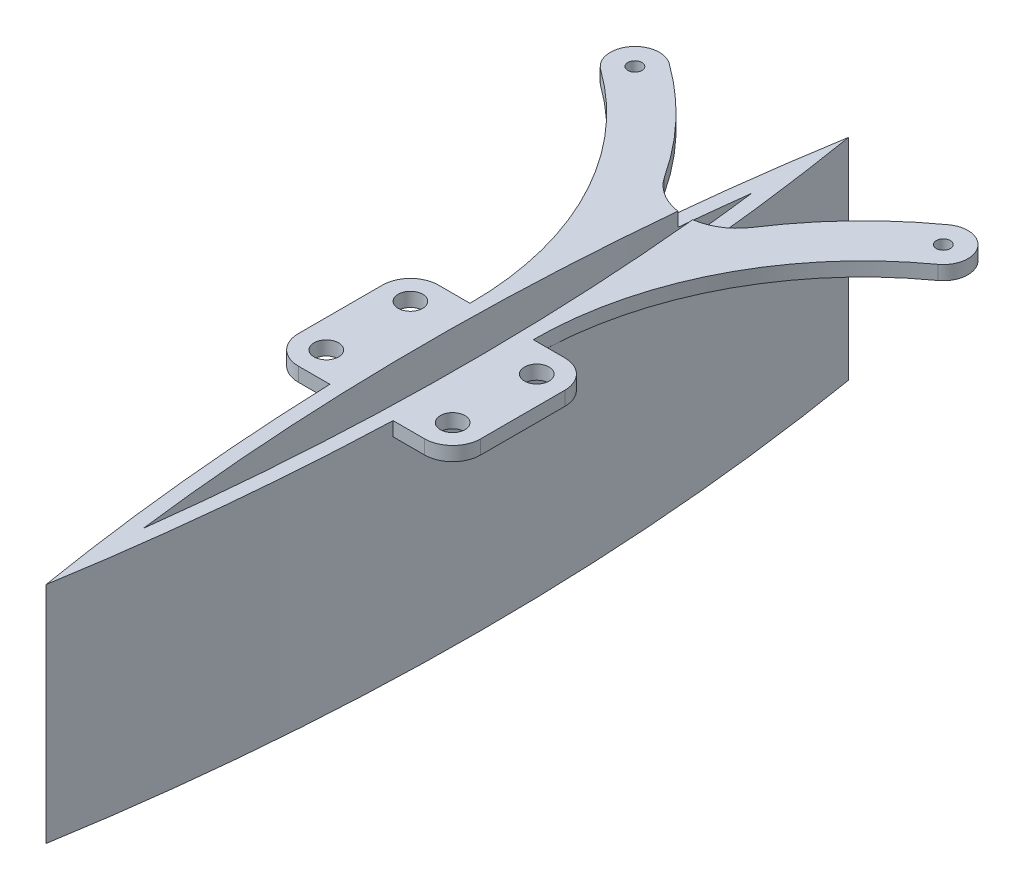
from build123d import *

# Parameters (mm, degrees)
ESQUISSE1_R             = 1
ESQUISSE1_R_2           = 1.75
BOSS_EXTRU_1_DEPTH      = 2
BOSS_EXTRU_2_DEPTH      = 30
ENL_V_MAT_EXTRU_1_DEPTH = 30


with BuildPart() as part:
    # Esquisse1 → Boss.-Extru.1 (new body)
    with BuildSketch(Plane(origin=(-102.847426705, 0, 18.134776225), x_dir=(-0.9358900387216226, 0, 0.3522922585320884), z_dir=(0, -1, 0))):
        with BuildLine():
            Line((-35.783043535, -7.317032149), (-31.571538361, -5.731716986))
            ThreePointArc((-31.571538361, -5.731716986), (-43.962728769, 12.509421297), (-63.307120355, 23.095980688))
            ThreePointArc((-63.307120355, 23.095980688), (-65.772276028, 27.388183794), (-61.480072922, 29.853339467))
            ThreePointArc((-61.480072922, 29.853339467), (-52.160976528, 26.38573664), (-43.635247367, 21.268924229))
            ThreePointArc((-43.635247367, 21.268924229), (-36.558040325, 20.298062653), (-31.877901634, 25.694888901))
            ThreePointArc((-31.877901634, 25.694888901), (-28.844792662, 35.160970009), (-24.13003355, 43.911826431))
            ThreePointArc((-24.13003355, 43.911826431), (-19.278127956, 44.891118068), (-18.298836319, 40.039212475))
            ThreePointArc((-18.298836319, 40.039212475), (-25.857183507, 19.312066118), (-23.140463625, -2.582285696))
            Line((-23.140463625, -2.582285696), (-18.928966989, -0.996992769))
            ThreePointArc((-18.928966989, -0.996992769), (-15.86913456, -1.097035278), (-13.776247036, -3.331404275))
            Line((-13.776247036, -3.331404275), (-9.548784363, -14.562101464))
            ThreePointArc((-9.548784363, -14.562101464), (-9.648826872, -17.621933894), (-11.883195869, -19.714821418))
            Line((-11.883195869, -19.714821418), (-16.094692505, -21.300114345))
            ThreePointArc((-16.094692505, -21.300114345), (-9.56964495, -42.95687912), (-4.457038078, -64.989876126))
            ThreePointArc((-4.457038078, -64.989876126), (-15.147005435, -45.044257691), (-24.52569319, -24.44951776))
            Line((-24.52569319, -24.44951776), (-28.737198365, -26.034832924))
            ThreePointArc((-28.737198365, -26.034832924), (-31.79703119, -25.93480252), (-33.889927554, -23.700441803))
            Line((-33.889927554, -23.700441803), (-38.117434656, -12.469761338))
            ThreePointArc((-38.117434656, -12.469761338), (-38.017404252, -9.409928513), (-35.783043535, -7.317032149))
        make_face()
        with Locations((-62.393596638, 26.474660077)):
            Circle(ESQUISSE1_R, mode=Mode.SUBTRACT)
        with Locations((-34.373874501, -11.060592304)):
            Circle(ESQUISSE1_R_2, mode=Mode.SUBTRACT)
        with Locations((-30.146367399, -22.291272769)):
            Circle(ESQUISSE1_R_2, mode=Mode.SUBTRACT)
        with Locations((-13.292350093, -15.971255688)):
            Circle(ESQUISSE1_R_2, mode=Mode.SUBTRACT)
        with Locations((-17.519812765, -4.740558499)):
            Circle(ESQUISSE1_R_2, mode=Mode.SUBTRACT)
        with Locations((-21.214434935, 41.975519453)):
            Circle(ESQUISSE1_R, mode=Mode.SUBTRACT)
    extrude(amount=BOSS_EXTRU_1_DEPTH)

    # Esquisse2 → Boss.-Extru.2 (add)
    with BuildSketch(Plane(origin=(0, -2, 0), x_dir=(-1, 0, 0), z_dir=(0, -1, 0))):
        with BuildLine():
            ThreePointArc((75.781706302, 37.119112687), (71.06663784, -20.134389129), (75.780698923, -77.387973898))
            ThreePointArc((75.780698923, -77.387973898), (80.495767385, -20.134472082), (75.781706302, 37.119112687))
        make_face()
    extrude(amount=BOSS_EXTRU_2_DEPTH)

    # Esquisse3 → Enlèv. mat.-Extru.1 (cut)
    with BuildSketch(Plane(origin=(0, 0, 0), x_dir=(1, 0, 0), z_dir=(0, 1, 0))):
        with BuildLine():
            ThreePointArc((-75.781584264, 23.247227035), (-78.495767385, -20.134454487), (-75.780820962, -63.516088246))
            ThreePointArc((-75.780820962, -63.516088246), (-73.06663784, -20.134406724), (-75.781584264, 23.247227035))
        make_face()
    extrude(amount=-ENL_V_MAT_EXTRU_1_DEPTH, mode=Mode.SUBTRACT)


solid = part.part
